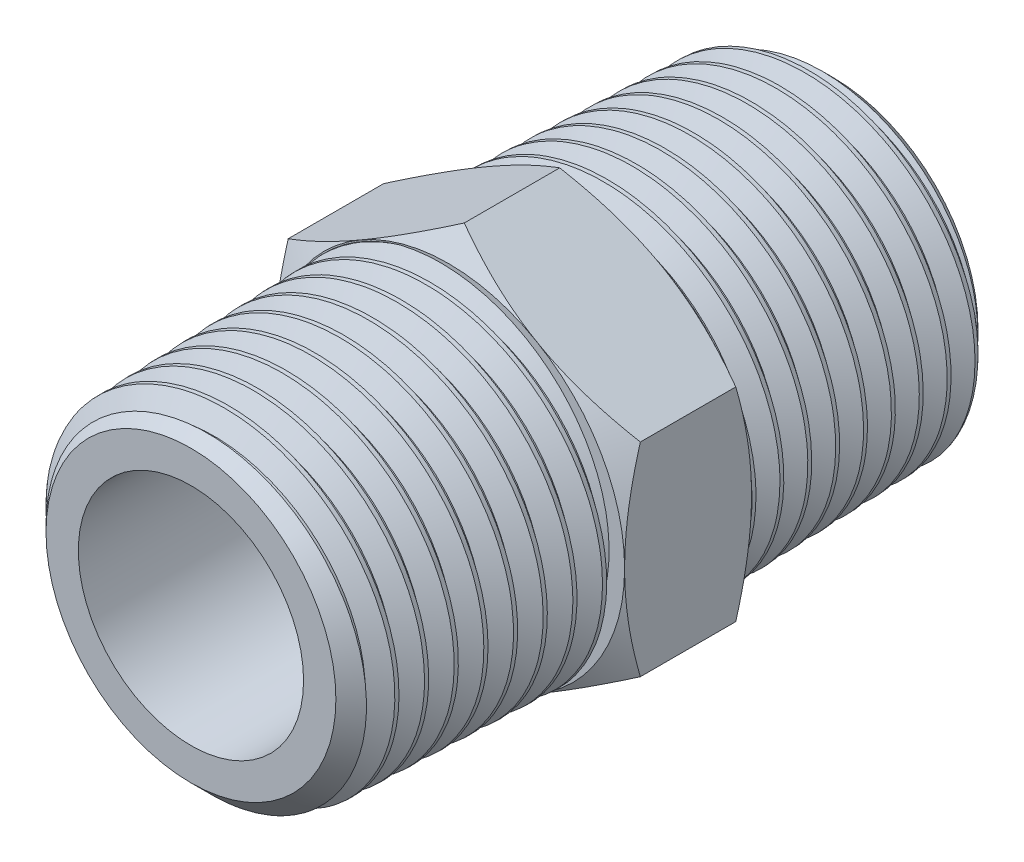
from build123d import *

# Parameters (mm, degrees)
BOSS_EXTRUDE1_DEPTH      = 3.1115
BOSS_EXTRUDE1_DEPTH_BACK = 3.1115
SKETCH3_R                = 8.5725
BOSS_EXTRUDE2_DEPTH      = 12.6365
BOSS_EXTRUDE2_TAPER      = 1.783333333
CUT_SWEEP1_PITCH         = 1.411794907
CUT_SWEEP1_HEIGHT        = 14.047611111
CUT_SWEEP1_RADIUS        = 8.179061395
CUT_SWEEP1_START_ANGLE   = 90
SKETCH6_OUTSIDE_W        = 73.788
SKETCH6_OUTSIDE_H        = 76.46
SKETCH6_OUTSIDE_R        = 7.109760584
CUT_EXTRUDE1_DEPTH       = 24.015253585
CUT_EXTRUDE1_DRAFT       = -45
CIRPATTERN1_COUNT        = 2
SKETCH7_W                = 31.496
SKETCH7_H                = 5.5245


with BuildPart() as part:
    # Sketch2 → Boss-Extrude1 (new, two sides: drawn at the far end of the back side and taken through both)
    with BuildSketch(Plane.XY.offset(-BOSS_EXTRUDE1_DEPTH_BACK)):
        Polygon((0, 9.971993849), (-8.636, 4.985996925), (-8.636, -4.985996925), (0, -9.971993849), (8.636, -4.985996925), (8.636, 4.985996925), align=None)
    extrude(amount=BOSS_EXTRUDE1_DEPTH + BOSS_EXTRUDE1_DEPTH_BACK)


with BuildPart() as body_2:
    # Sketch3 → Boss-Extrude2 (new body)
    with BuildSketch(Plane.XY.offset(3.1115)):
        Circle(SKETCH3_R)
    extrude(amount=BOSS_EXTRUDE2_DEPTH, taper=BOSS_EXTRUDE2_TAPER)

    # Cut-Sweep1: sweep along a helix
    with BuildLine() as cut_sweep1_path:
        # a taper helix: rise per turn along the axis 1.411111111, along the cone's slant (build123d's pitch) 1.411794907
        add(Helix(CUT_SWEEP1_PITCH, CUT_SWEEP1_HEIGHT, CUT_SWEEP1_RADIUS, center=(0, 0, 15.748), direction=(0, 0, -1), cone_angle=1.783333333, mode=Mode.PRIVATE).rotate(Axis((0, 0, 15.748), (0, 0, -1)), CUT_SWEEP1_START_ANGLE))
    # Sketch5 → Cut-Sweep1 (sweep, cut)
    with BuildSketch(Plane(origin=(0, 0, 0), x_dir=(0, 0, -1), z_dir=(1, 0, 0))):
        Polygon((-17.026819444, 8.255440024), (-15.659805556, 8.331818653), (-16.277166667, 7.262517842), (-16.453555556, 7.262517842), align=None)
    sweep(path=cut_sweep1_path.line, is_frenet=True, mode=Mode.SUBTRACT)


with BuildPart() as cut_extrude1_tool:
    # Sketch6 outside → Cut-Extrude1 (with draft: the straight prism first)
    with BuildSketch(Plane.XY.offset(15.748)):
        Rectangle(SKETCH6_OUTSIDE_W, SKETCH6_OUTSIDE_H)
        Circle(SKETCH6_OUTSIDE_R, mode=Mode.SUBTRACT)
    extrude(amount=-CUT_EXTRUDE1_DEPTH)
    # Cut-Extrude1: the draft: its side faces are tilted about the plane it starts from
    cut_extrude1_sides = [cut_extrude1_tool.faces().sort_by_distance(p)[0] for p in [
        (0, -38.23, 3.740373207),
        (36.894, 0, 3.740373207),
        (0, 38.23, 3.740373207),
        (-36.894, 0, 3.740373207),
        (-7.109760584, 0, 3.740373207),
    ]]
    draft(cut_extrude1_sides, Plane.XY.offset(15.748), CUT_EXTRUDE1_DRAFT)


with BuildPart() as body_2_1:
    add(body_2.part)

    # Cut-Extrude1: cut by cut_extrude1_tool
    add(cut_extrude1_tool.part, mode=Mode.SUBTRACT)


with BuildPart() as cirpattern1_1:
    # CirPattern1: pattern copy
    add(body_2_1.part.rotate(Axis((0, 7.057385353, 0), (0, -1, 0)), 1 * 360 / CIRPATTERN1_COUNT))


with BuildPart() as part_1:
    add(part.part)

    # Combine1: union CirPattern1_1, body 2
    add(cirpattern1_1.part)
    add(body_2_1.part)

    # Sketch7 → Cut-Revolve1 (revolve, cut)
    with BuildSketch(Plane(origin=(0, 0, 0), x_dir=(0, 0, -1), z_dir=(1, 0, 0)), mode=Mode.PRIVATE) as cut_revolve1_sk:
        Polygon((-3.1115, 8.636), (-3.1115, 9.971993849), (-2.340163591, 9.971993849), align=None)
        with Locations((0, 2.76225)):
            Rectangle(SKETCH7_W, SKETCH7_H)
        Polygon((3.1115, 9.971993849), (3.1115, 8.636), (2.340163591, 9.971993849), align=None)
    revolve(cut_revolve1_sk.sketch.rotate(Axis((0, 0, 15.748), (0, 0, -1)), 90), axis=Axis((0, 0, 15.748), (0, 0, -1)), mode=Mode.SUBTRACT)


solid = part_1.part
